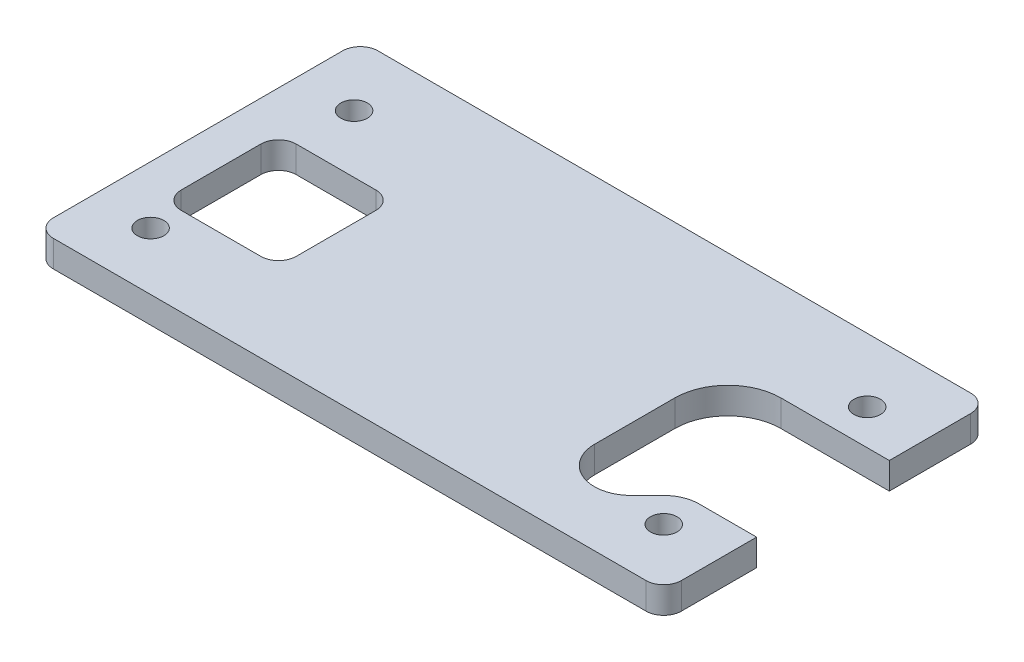
from build123d import *

# Parameters (mm, degrees)
SKETCH1_W           = 71
SKETCH1_H           = 36.7
SKETCH1_R           = 1.5
BOSS_EXTRUDE1_DEPTH = 3
SKETCH2_W           = 13
SKETCH2_H           = 13
CUT_EXTRUDE1_DEPTH  = 41.07458671
FILLET1_R           = 2
FILLET2_R           = 2


with BuildPart() as part:
    # Sketch1 → Boss-Extrude1 (new body)
    with BuildSketch(Plane(origin=(0, 0, 0), x_dir=(1, 0, 0), z_dir=(0, 1, 0))):
        Rectangle(SKETCH1_W, SKETCH1_H)
        with Locations((-29, -11.85)):
            Circle(SKETCH1_R, mode=Mode.SUBTRACT)
        with Locations((29, -11.85)):
            Circle(SKETCH1_R, mode=Mode.SUBTRACT)
        with Locations((29, 11.15)):
            Circle(SKETCH1_R, mode=Mode.SUBTRACT)
        with Locations((-29, 11.15)):
            Circle(SKETCH1_R, mode=Mode.SUBTRACT)
    extrude(amount=BOSS_EXTRUDE1_DEPTH)

    # Sketch2 → Cut-Extrude1 (cut, through all)
    with BuildSketch(Plane(origin=(0, 3, 0), x_dir=(1, 0, 0), z_dir=(0, 1, 0))):
        with Locations((-24.5, -1.89)):
            Rectangle(SKETCH2_W, SKETCH2_H)
        with BuildLine():
            Line((17.25, 1.15), (17.25, -7.934129881))
            ThreePointArc((17.25, -7.934129881), (19.809314312, -11.764414428), (24.327442995, -10.865702756))
            Line((24.327442995, -10.865702756), (26.171572875, -9.021572875))
            ThreePointArc((26.171572875, -9.021572875), (27.469266271, -8.15448187), (29, -7.85))
            Line((29, -7.85), (35.5, -7.85))
            Line((35.5, -7.85), (35.5, 7.15))
            Line((35.5, 7.15), (23.25, 7.15))
            ThreePointArc((23.25, 7.15), (19.007359313, 5.392640687), (17.25, 1.15))
        make_face()
    extrude(amount=-CUT_EXTRUDE1_DEPTH, mode=Mode.SUBTRACT)

    # Fillet1
    fillet1_edges = [part.edges().sort_by_distance(p)[0] for p in [
        (-18, 1.5, 8.39),
        (-31, 1.5, 8.39),
        (-18, 1.5, -4.61),
        (-31, 1.5, -4.61),
    ]]
    fillet(fillet1_edges, radius=FILLET1_R)

    # Fillet2
    fillet2_edges = [part.edges().sort_by_distance(p)[0] for p in [
        (35.5, 1.5, -18.35),
        (35.5, 1.5, 18.35),
        (-35.5, 1.5, 18.35),
        (-35.5, 1.5, -18.35),
    ]]
    fillet(fillet2_edges, radius=FILLET2_R)


solid = part.part
